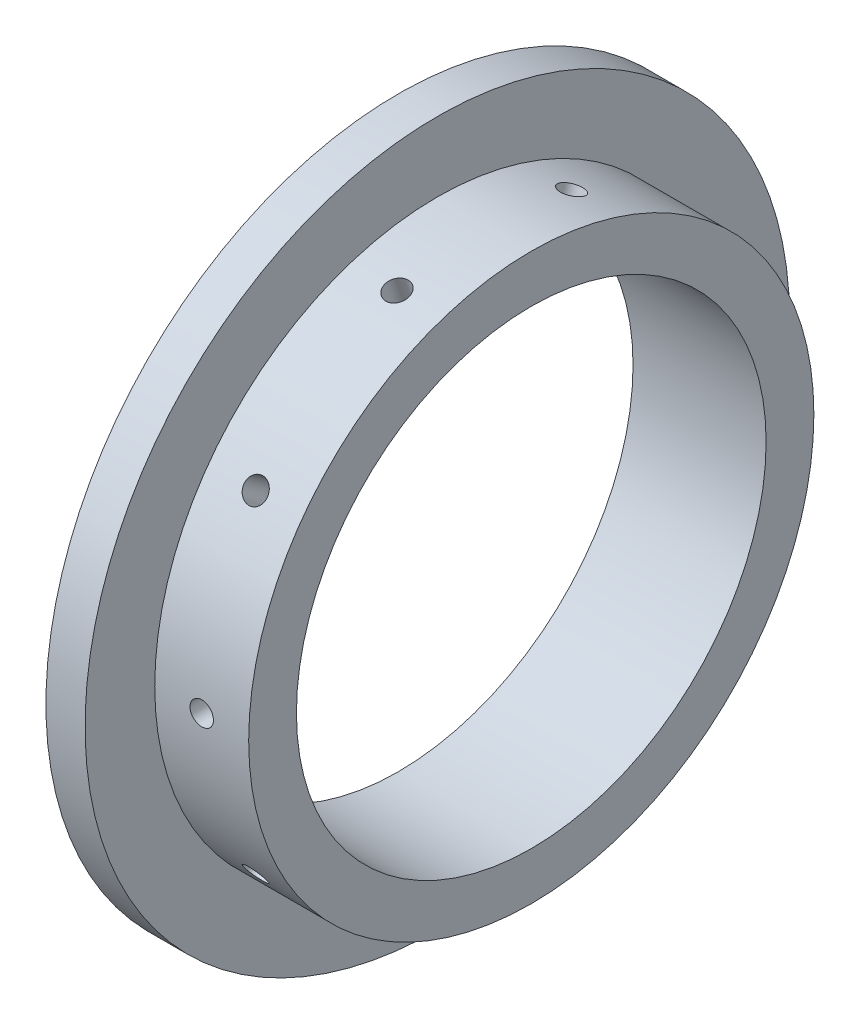
from build123d import *

# Parameters (mm, degrees)
SKETCH1_R           = 57.15
SKETCH1_R_2         = 38.1
BOSS_EXTRUDE1_DEPTH = 6.35
SKETCH2_R           = 45.847
SKETCH2_R_2         = 38.1
BOSS_EXTRUDE2_DEPTH = 15.24
SKETCH4_R           = 1.89865
CUT_EXTRUDE1_DEPTH  = 7.62
CIRPATTERN1_COUNT   = 10


with BuildPart() as part:
    # Sketch1 → Boss-Extrude1 (new body)
    with BuildSketch(Plane(origin=(0, 0, 0), x_dir=(0, 0, -1), z_dir=(1, 0, 0))):
        Circle(SKETCH1_R)
        Circle(SKETCH1_R_2, mode=Mode.SUBTRACT)
    extrude(amount=BOSS_EXTRUDE1_DEPTH)

    # Sketch2 → Boss-Extrude2 (add)
    with BuildSketch(Plane(origin=(6.35, 0, 0), x_dir=(0, 0, -1), z_dir=(1, 0, 0))):
        Circle(SKETCH2_R)
        Circle(SKETCH2_R_2, mode=Mode.SUBTRACT)
    extrude(amount=BOSS_EXTRUDE2_DEPTH)

    # Sketch4 → Cut-Extrude1 (cut)
    with BuildSketch(Plane(origin=(0, 0, -45.847), x_dir=(-1, 0, 0), z_dir=(0, 0, -1))):
        with Locations((-13.97, 0)):
            Circle(SKETCH4_R)
    cut_extrude1 = extrude(amount=-CUT_EXTRUDE1_DEPTH, mode=Mode.SUBTRACT)

    # CirPattern1: Cut-Extrude1 ×10 about axis
    cirpattern1_axis = Axis((0, 0, 0), (1, 0, 0))
    for i in range(1, CIRPATTERN1_COUNT):
        add(cut_extrude1.rotate(cirpattern1_axis, i * 360 / CIRPATTERN1_COUNT), mode=Mode.SUBTRACT)


solid = part.part
